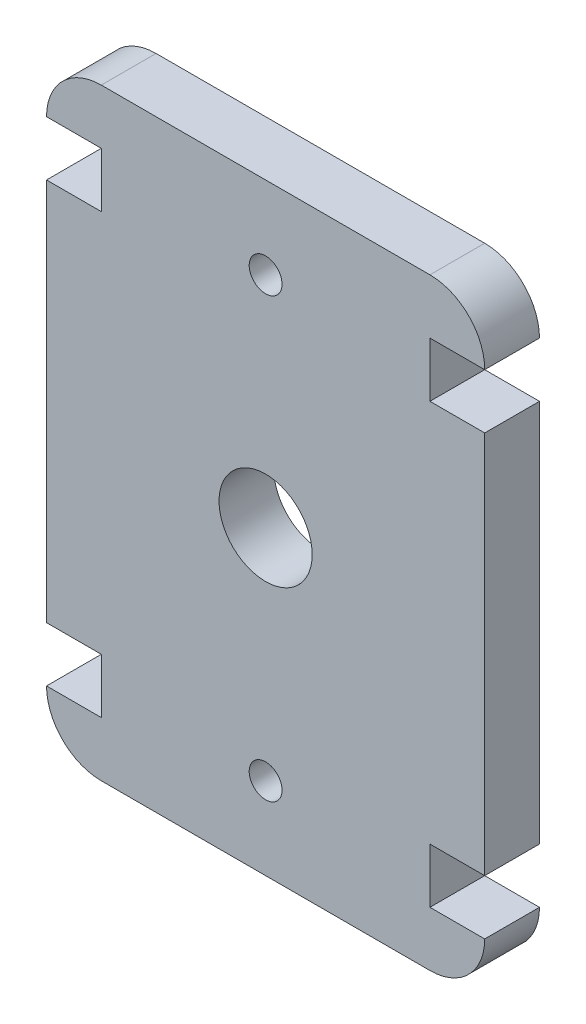
from build123d import *

# Parameters (mm, degrees)
ESQUISSE1_R        = 1.5
ESQUISSE1_R_2      = 4.25
BOSS_EXTRU_1_DEPTH = 5
CONG_1_R           = 5


with BuildPart() as part:
    # Esquisse1 → Boss.-Extru.1 (new body)
    with BuildSketch(Plane.XY):
        Polygon((-20, 0), (20, 0), (20, 5), (15, 5), (15, 10), (20, 10), (20, 45), (15, 45), (15, 50), (20, 50), (20, 55), (-20, 55), (-20, 50), (-15, 50), (-15, 45), (-20, 45), (-20, 10), (-15, 10), (-15, 5), (-20, 5), align=None)
        with Locations((0, 47.5)):
            Circle(ESQUISSE1_R, mode=Mode.SUBTRACT)
        with Locations((0, 7.5)):
            Circle(ESQUISSE1_R, mode=Mode.SUBTRACT)
        with Locations((0, 27.5)):
            Circle(ESQUISSE1_R_2, mode=Mode.SUBTRACT)
    extrude(amount=BOSS_EXTRU_1_DEPTH)

    # Congé1
    cong_1_edges = [part.edges().sort_by_distance(p)[0] for p in [
        (20, 55, 2.5),
        (20, 0, 2.5),
        (-20, 0, 2.5),
        (-20, 55, 2.5),
    ]]
    fillet(cong_1_edges, radius=CONG_1_R - 0.0001)  # a hair under: the kernel refuses the full size


solid = part.part
